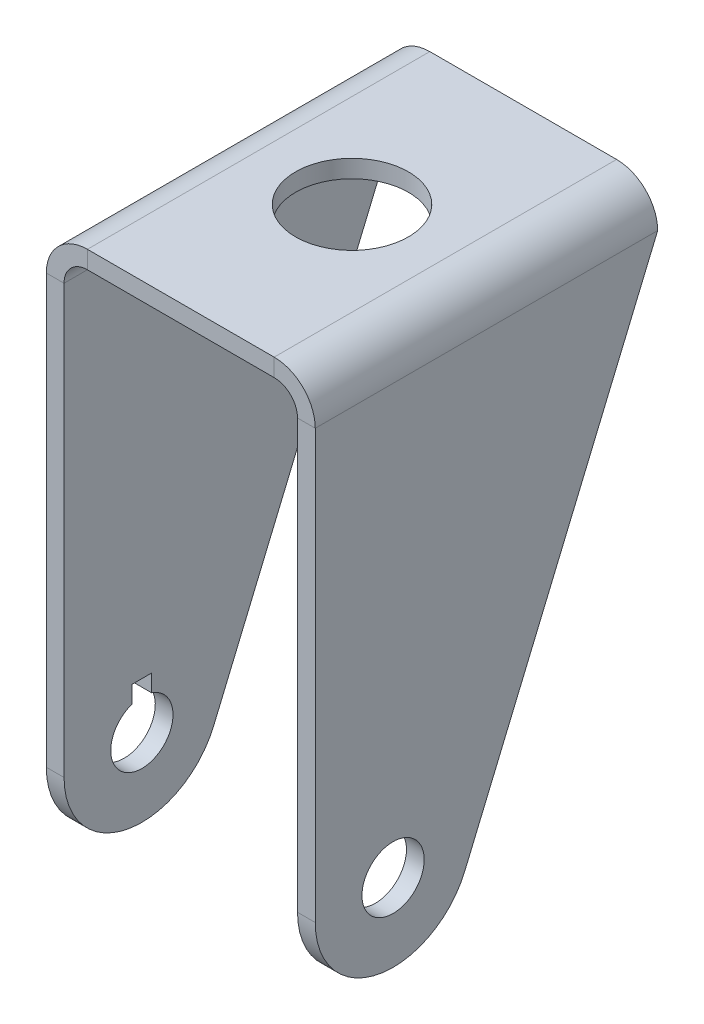
from build123d import *

# Parameters (mm, degrees)
BASE_FLANGE1_DEPTH = 22
CUT_EXTRUDE2_START = -34.556
CUT_EXTRUDE2_DEPTH = 34.556
SKETCH9_R          = 4
CUT_EXTRUDE3_DEPTH = 82.345647825
SKETCH10_R         = 7.25
CUT_EXTRUDE4_DEPTH = 76.640773185
CUT_EXTRUDE5_REACH = 83.346


# Read off the part's stored shape, not the designer's step: Cut-Extrude2
# Sheet-metal steps are written as plain solids
with BuildPart() as part:
    # Sketch2 → Base-Flange1 (new, symmetric)
    with BuildSketch(Plane.XY):
        with BuildLine():
            Line((15, 0), (15, 65))
            ThreePointArc((15, 65), (14.121320344, 67.121320344), (12, 68))
            Line((12, 68), (-12, 68))
            ThreePointArc((-12, 68), (-14.121320344, 67.121320344), (-15, 65))
            Line((-15, 65), (-15, 0))
            Line((-15, 0), (-17.278, 0))
            Line((-17.278, 0), (-17.278, 65))
            ThreePointArc((-17.278, 65), (-15.732109591, 68.732109591), (-12, 70.278))
            Line((-12, 70.278), (12, 70.278))
            ThreePointArc((12, 70.278), (15.732109591, 68.732109591), (17.278, 65))
            Line((17.278, 65), (17.278, 0))
            Line((17.278, 0), (15, 0))
        make_face()
    extrude(amount=BASE_FLANGE1_DEPTH, both=True)

    # Cut-Extrude2 outline → Cut-Extrude2 (cut)
    with BuildSketch(Plane(origin=(17.278, 0, 0), x_dir=(0, 0, -1), z_dir=(1, 0, 0)).offset(CUT_EXTRUDE2_START)):
        with BuildLine():
            Line((22, 65), (-2.783188769, 6.120516693))
            ThreePointArc((-2.783188769, 6.120516693), (-6.468039819, 1.669488818), (-12.000000004, 0))
            Line((-12.000000004, 0), (22, 0))
            Line((22, 0), (22, 65))
        make_face()
        with BuildLine():
            Line((-22, 0), (-12.000000004, 0))
            ThreePointArc((-12.000000004, 0), (-19.071067813, 2.92893219), (-22, 10))
            Line((-22, 10), (-22, 0))
        make_face()
    extrude(amount=CUT_EXTRUDE2_DEPTH, mode=Mode.SUBTRACT)

    # Sketch9 → Cut-Extrude3 (cut, through all)
    with BuildSketch(Plane(origin=(17.278, 0, 0), x_dir=(0, 0, -1), z_dir=(1, 0, 0))):
        with Locations((-12, 10)):
            Circle(SKETCH9_R)
    extrude(amount=-CUT_EXTRUDE3_DEPTH, mode=Mode.SUBTRACT)

    # Sketch10 → Cut-Extrude4 (cut, through all)
    with BuildSketch(Plane(origin=(0, 70.278, 0), x_dir=(1, 0, 0), z_dir=(0, 1, 0))):
        with Locations(Location((0, 0, 0), (0, 0, 270))):
            Circle(SKETCH10_R)
    extrude(amount=-CUT_EXTRUDE4_DEPTH, mode=Mode.SUBTRACT)

    # Sketch13 → Cut-Extrude5 (cut, up to next)
    with BuildSketch(Plane.ZY.offset(17.278), mode=Mode.PRIVATE) as cut_extrude5_sk1:
        with BuildLine():
            ThreePointArc((10.75, 13.799671038), (12, 14), (13.25, 13.799671038))
            Line((13.25, 13.799671038), (13.25, 16))
            Line((13.25, 16), (10.75, 16))
            Line((10.75, 16), (10.75, 13.799671038))
        make_face()
    cut_extrude5_tool1 = extrude(cut_extrude5_sk1.sketch, amount=-CUT_EXTRUDE5_REACH, mode=Mode.PRIVATE) & part.part
    add(cut_extrude5_tool1.solids().sort_by_distance((-17.278, 14.966097, 12))[0], mode=Mode.SUBTRACT)


solid = part.part
